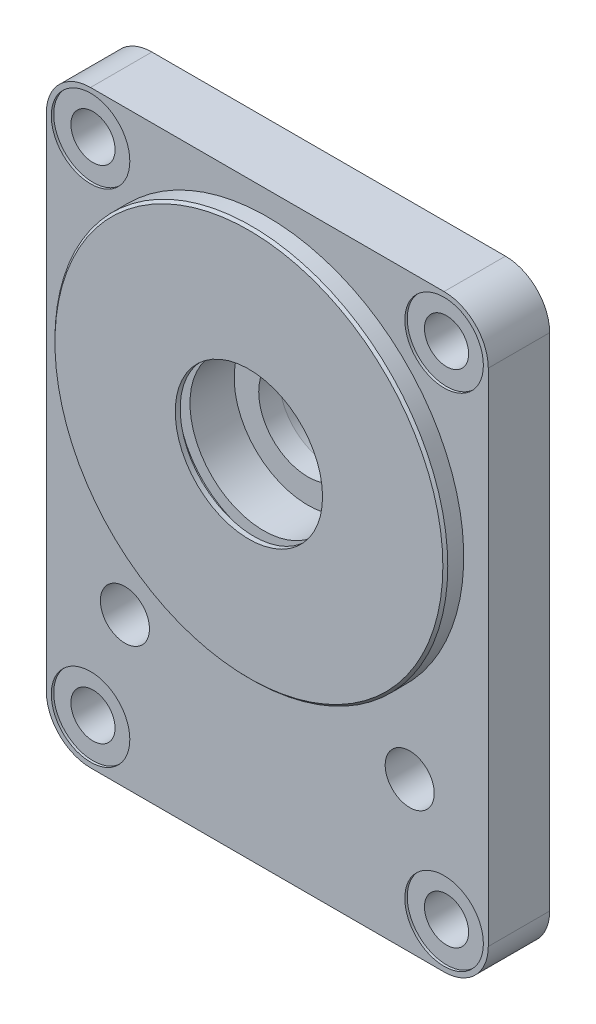
from build123d import *

# Parameters (mm, degrees)
BOSS_EXTRUDE1_DEPTH = 6.25
SKETCH2_R           = 10
SKETCH2_R_2         = 5
BOSS_EXTRUDE2_DEPTH = 3
BOSS_EXTRUDE2_DRAFT = 10
SKETCH3_R           = 5
SKETCH3_R_2         = 10
CUT_EXTRUDE1_DEPTH  = 77.034531629
SKETCH5_R           = 40
BOSS_EXTRUDE3_DEPTH = 3.75
SKETCH6_R           = 15
CUT_EXTRUDE2_DEPTH  = 1
SKETCH7_R           = 17.5
CUT_EXTRUDE3_DEPTH  = 2
SKETCH8_R           = 15
CUT_EXTRUDE4_DEPTH  = 9
SKETCH11_R          = 4.5
CUT_EXTRUDE5_DEPTH  = 77.584920187
SKETCH13_R          = 8
CUT_EXTRUDE6_DEPTH  = 0.5
CHAMFER1_SIZE       = 0.5
SKETCH14_R          = 2
CUT_EXTRUDE8_DEPTH  = 3
CHAMFER2_SIZE       = 0.5


with BuildPart() as part:
    # Sketch1 → Boss-Extrude1 (new, symmetric)
    with BuildSketch(Plane.XY):
        with BuildLine():
            Line((-36, -60), (36, -60))
            ThreePointArc((36, -60), (42.363961031, -57.363961031), (45, -51))
            Line((45, -51), (45, 51))
            ThreePointArc((45, 51), (42.363961031, 57.363961031), (36, 60))
            Line((36, 60), (-36, 60))
            ThreePointArc((-36, 60), (-42.363961031, 57.363961031), (-45, 51))
            Line((-45, 51), (-45, -51))
            ThreePointArc((-45, -51), (-42.363961031, -57.363961031), (-36, -60))
        make_face()
    extrude(amount=BOSS_EXTRUDE1_DEPTH, both=True)


with BuildPart() as boss_extrude2_tool:
    # Sketch2 → Boss-Extrude2 (with draft: the straight prism first)
    with BuildSketch(Plane(origin=(0, 0, -6.25), x_dir=(-1, 0, 0), z_dir=(0, 0, -1))):
        with BuildLine():
            ThreePointArc((42, 27.129319933), (41.019345657, 28.590440394), (39.987883834, 30.016148096))
            ThreePointArc((39.987883834, 30.016148096), (36.711412809, 37.344368202), (29.328259336, 40.495100991))
            ThreePointArc((29.328259336, 40.495100991), (0, 50), (-29.328259336, 40.495100991))
            ThreePointArc((-29.328259336, 40.495100991), (-36.711412809, 37.344368202), (-39.987883834, 30.016148096))
            ThreePointArc((-39.987883834, 30.016148096), (-41.019345657, 28.590440394), (-42, 27.129319933))
            Line((-42, 27.129319933), (-42, -27.129319933))
            ThreePointArc((-42, -27.129319933), (-41.019345657, -28.590440394), (-39.987883834, -30.016148096))
            ThreePointArc((-39.987883834, -30.016148096), (-36.711412809, -37.344368202), (-29.328259336, -40.495100991))
            ThreePointArc((-29.328259336, -40.495100991), (0, -50), (29.328259336, -40.495100991))
            ThreePointArc((29.328259336, -40.495100991), (36.711412809, -37.344368202), (39.987883834, -30.016148096))
            ThreePointArc((39.987883834, -30.016148096), (41.019345657, -28.590440394), (42, -27.129319933))
            Line((42, -27.129319933), (42, 27.129319933))
        make_face()
        with Locations((0, 15.2)):
            Circle(SKETCH2_R, mode=Mode.SUBTRACT)
        with Locations((29, 29.5)):
            Circle(SKETCH2_R_2, mode=Mode.SUBTRACT)
        with Locations((29, -29.5)):
            Circle(SKETCH2_R_2, mode=Mode.SUBTRACT)
        with Locations((-29, -29.5)):
            Circle(SKETCH2_R_2, mode=Mode.SUBTRACT)
        with Locations((-29, 29.5)):
            Circle(SKETCH2_R_2, mode=Mode.SUBTRACT)
    extrude(amount=BOSS_EXTRUDE2_DEPTH)
    # Boss-Extrude2: the draft: its side faces are tilted about the plane it starts from
    boss_extrude2_sides = [boss_extrude2_tool.faces().sort_by_distance(p)[0] for p in [
        (0, -50, -7.75),
        (-36.711412809, -37.344368202, -7.75),
        (-41.019345657, -28.590440394, -7.75),
        (-42, 0, -7.75),
        (-41.019345657, 28.590440394, -7.75),
        (-36.711412809, 37.344368202, -7.75),
        (0, 50, -7.75),
        (36.711412809, 37.344368202, -7.75),
        (41.019345657, 28.590440394, -7.75),
        (42, 0, -7.75),
        (41.019345657, -28.590440394, -7.75),
        (36.711412809, -37.344368202, -7.75),
        (10, 15.2, -7.75),
        (-24, 29.5, -7.75),
        (-24, -29.5, -7.75),
        (34, -29.5, -7.75),
        (34, 29.5, -7.75),
    ]]
    draft(boss_extrude2_sides, Plane(origin=(0, 0, -6.25), x_dir=(-1, 0, 0), z_dir=(0, 0, -1)), BOSS_EXTRUDE2_DRAFT)


with BuildPart() as part_1:
    add(part.part)

    # Boss-Extrude2: add boss_extrude2_tool
    add(boss_extrude2_tool.part)

    # Sketch3 → Cut-Extrude1 (cut, through all)
    with BuildSketch(Plane(origin=(0, 0, -6.25), x_dir=(-1, 0, 0), z_dir=(0, 0, -1))):
        with Locations((29, -29.5)):
            Circle(SKETCH3_R)
        with Locations((-29, -29.5)):
            Circle(SKETCH3_R)
        with Locations((29, 29.5)):
            Circle(SKETCH3_R)
        with Locations((-29, 29.5)):
            Circle(SKETCH3_R)
        with Locations((0, 15.2)):
            Circle(SKETCH3_R_2)
    extrude(amount=-CUT_EXTRUDE1_DEPTH, mode=Mode.SUBTRACT)

    # Sketch5 → Boss-Extrude3 (add, symmetric)
    with BuildSketch(Plane.XY.offset(6.25)):
        with Locations((0, 15.2)):
            Circle(SKETCH5_R)
    extrude(amount=BOSS_EXTRUDE3_DEPTH, both=True)

    # Sketch6 → Cut-Extrude2 (cut)
    with BuildSketch(Plane.XY.offset(10)):
        with Locations((0, 15.2)):
            Circle(SKETCH6_R)
    extrude(amount=-CUT_EXTRUDE2_DEPTH, mode=Mode.SUBTRACT)

    # Sketch7 → Cut-Extrude3 (cut)
    with BuildSketch(Plane.XY.offset(9)):
        with Locations((0, 15.2)):
            Circle(SKETCH7_R)
    extrude(amount=-CUT_EXTRUDE3_DEPTH, mode=Mode.SUBTRACT)

    # Sketch8 → Cut-Extrude4 (cut)
    with BuildSketch(Plane.XY.offset(7)):
        with Locations((0, 15.2)):
            Circle(SKETCH8_R)
    extrude(amount=-CUT_EXTRUDE4_DEPTH, mode=Mode.SUBTRACT)

    # Sketch11 → Cut-Extrude5 (cut, through all)
    with BuildSketch(Plane.XY.offset(6.25)):
        with Locations((36, 51)):
            Circle(SKETCH11_R)
        with Locations((-36, 51)):
            Circle(SKETCH11_R)
        with Locations((36, -51)):
            Circle(SKETCH11_R)
        with Locations((-36, -51)):
            Circle(SKETCH11_R)
    extrude(amount=-CUT_EXTRUDE5_DEPTH, mode=Mode.SUBTRACT)

    # Sketch13 → Cut-Extrude6 (cut)
    with BuildSketch(Plane.XY.offset(6.25)):
        with Locations((36, 51)):
            Circle(SKETCH13_R)
        with Locations((-36, 51)):
            Circle(SKETCH13_R)
        with Locations((-36, -51)):
            Circle(SKETCH13_R)
        with Locations((36, -51)):
            Circle(SKETCH13_R)
    extrude(amount=-CUT_EXTRUDE6_DEPTH, mode=Mode.SUBTRACT)

    # Chamfer1
    chamfer1_edges = [part_1.edges().sort_by_distance(p)[0] for p in [
        (-40, 15.2, 10),
    ]]
    chamfer(chamfer1_edges, length=CHAMFER1_SIZE)

    # Sketch14 → Cut-Extrude8 (cut)
    with BuildSketch(Plane(origin=(0, 0, -9.25), x_dir=(-1, 0, 0), z_dir=(0, 0, -1))):
        with Locations((0, 39.5)):
            Circle(SKETCH14_R)
        with Locations((0, -39.5)):
            Circle(SKETCH14_R)
    extrude(amount=-CUT_EXTRUDE8_DEPTH, mode=Mode.SUBTRACT)

    # Chamfer2
    chamfer2_edges = [part_1.edges().sort_by_distance(p)[0] for p in [
        (2, -39.5, -6.25),
        (2, 39.5, -6.25),
    ]]
    chamfer(chamfer2_edges, length=CHAMFER2_SIZE)


solid = part_1.part
